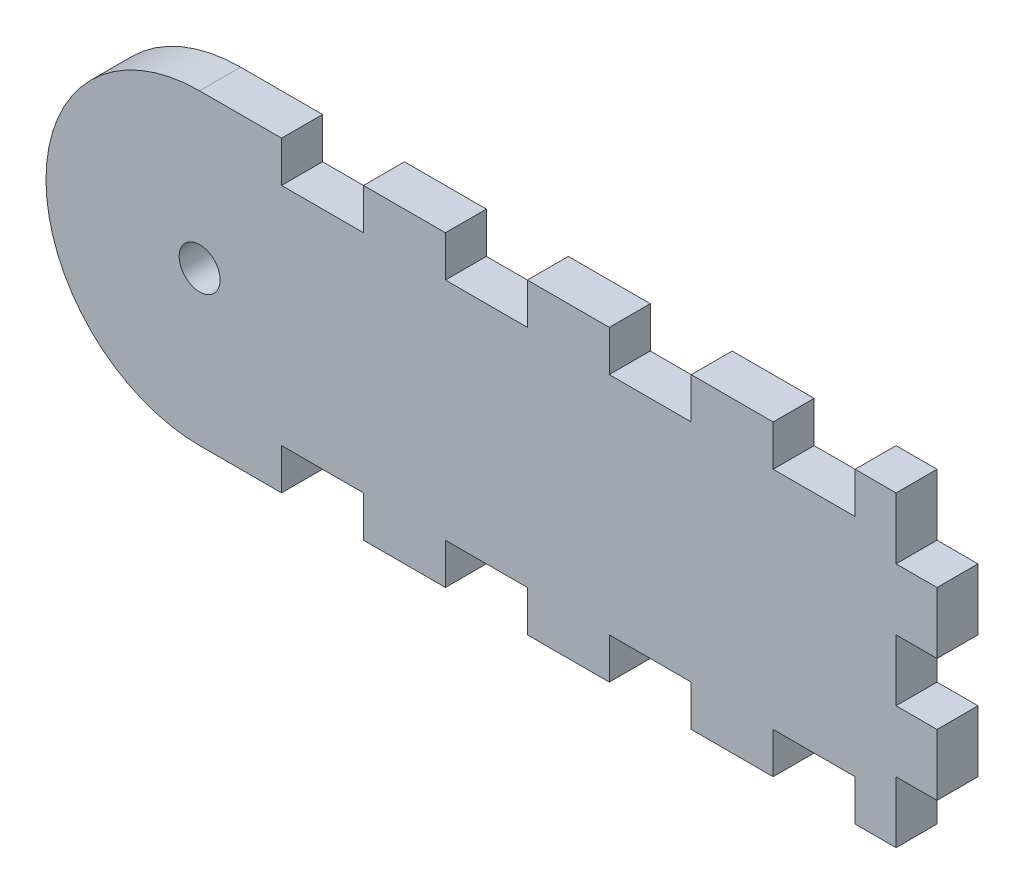
from build123d import *

# Parameters (mm, degrees)
MASS_DEPTH           = 6.35
SKETCH4_R            = 3.175
CUT_EXTRUDE1_DEPTH   = 85.630278639
SKETCH3_W            = 12.7
SKETCH3_H            = 12.7
CUT_EXTRUDE2_DEPTH   = 85.630278639
LPATTERN1_COUNT      = 4
LPATTERN1_PITCH      = 25.4
SKETCH5_W            = 12.7
SKETCH5_H            = 9.525
CUT_EXTRUDE3_DEPTH   = 85.630278639
LPATTERN2_COUNT      = 2
LPATTERN2_PITCH      = 19.05
LPATTERN2_COUNT_DIR2 = 2
LPATTERN2_PITCH_DIR2 = 19.05


with BuildPart() as part:
    # Sketch1 → Mass (new body)
    with BuildSketch(Plane.XY):
        with BuildLine():
            Line((-57.15, -23.8125), (57.15, -23.8125))
            Line((57.15, -23.8125), (57.15, 23.8125))
            Line((57.15, 23.8125), (-57.15, 23.8125))
            ThreePointArc((-57.15, 23.8125), (-80.9625, 0), (-57.15, -23.8125))
        make_face()
    extrude(amount=MASS_DEPTH)

    # Sketch4 → Cut-Extrude1 (cut, through all)
    with BuildSketch(Plane(origin=(0, 0, 0), x_dir=(-1, 0, 0), z_dir=(0, 0, -1))):
        with Locations((57.15, 0)):
            Circle(SKETCH4_R)
    extrude(amount=-CUT_EXTRUDE1_DEPTH, mode=Mode.SUBTRACT)

    # Sketch3 → Cut-Extrude2 (cut, through all)
    with BuildSketch(Plane(origin=(0, 0, 0), x_dir=(-1, 0, 0), z_dir=(0, 0, -1))):
        with Locations((-38.1, 23.8125)):
            Rectangle(SKETCH3_W, SKETCH3_H)
        with Locations((-38.1, -23.8125)):
            Rectangle(SKETCH3_W, SKETCH3_H)
    cut_extrude2 = extrude(amount=-CUT_EXTRUDE2_DEPTH, mode=Mode.SUBTRACT)

    # LPattern1: Cut-Extrude2 ×4
    with Locations(*[(-i * LPATTERN1_PITCH, 0, 0) for i in range(1, LPATTERN1_COUNT)]):
        add(cut_extrude2, mode=Mode.SUBTRACT)

    # Sketch5 → Cut-Extrude3 (cut, through all)
    with BuildSketch(Plane(origin=(0, 0, 0), x_dir=(-1, 0, 0), z_dir=(0, 0, -1))):
        with Locations((-57.15, 0)):
            Rectangle(SKETCH5_W, SKETCH5_H)
    cut_extrude3 = extrude(amount=-CUT_EXTRUDE3_DEPTH, mode=Mode.SUBTRACT)

    # LPattern2: Cut-Extrude3 2 × 2
    with Locations(*[Vector(0, -1, 0) * (i * LPATTERN2_PITCH) + Vector(0, 1, 0) * (j * LPATTERN2_PITCH_DIR2) for i in range(LPATTERN2_COUNT) for j in range(LPATTERN2_COUNT_DIR2) if (i, j) != (0, 0)]):
        add(cut_extrude3, mode=Mode.SUBTRACT)


solid = part.part
